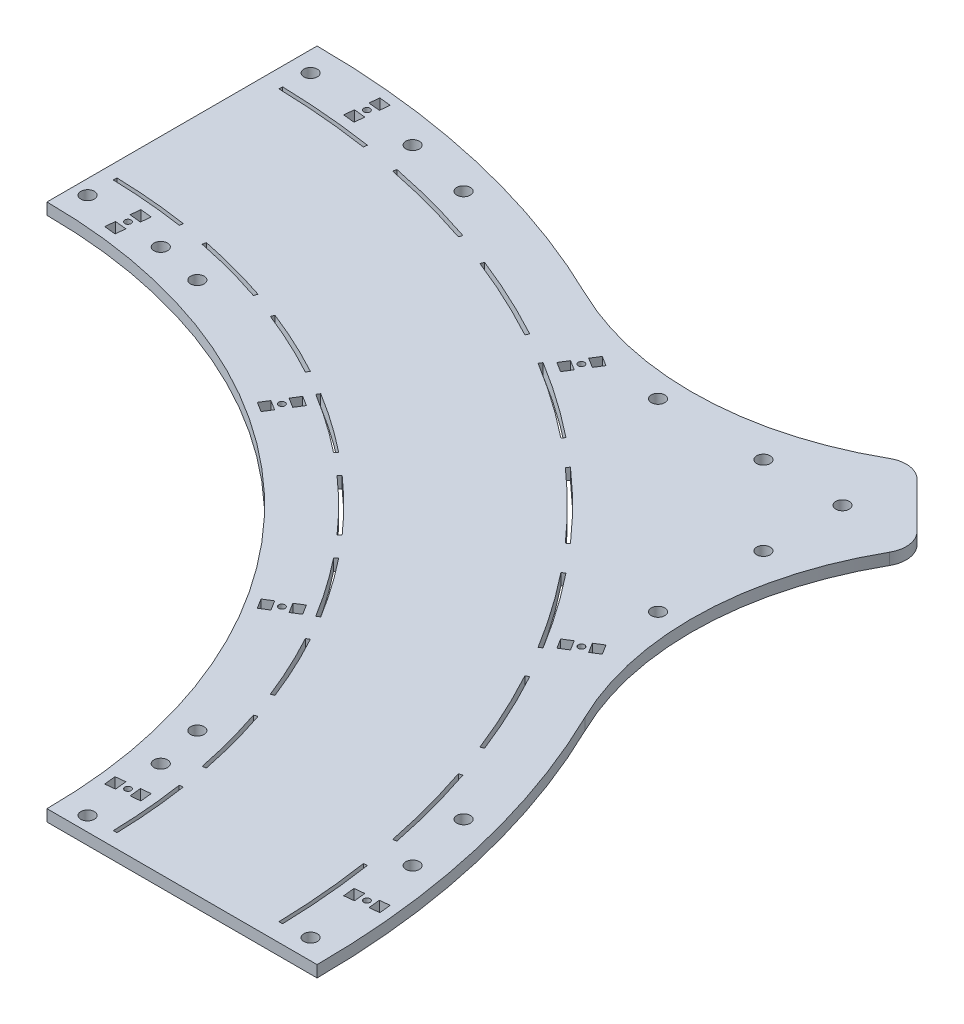
from build123d import *

# Parameters (mm, degrees)
BOSS_EXTRUDE1_DEPTH = 5.588
BOSS_EXTRUDE2_DEPTH = 5.588
CUT_EXTRUDE2_DEPTH  = 543.234577659
CIRPATTERN1_COUNT   = 36
SKETCH8_R           = 1.524
CUT_EXTRUDE3_DEPTH  = 543.234577659
CIRPATTERN3_COUNT   = 4
CIRPATTERN3_ANGLE   = 78
SKETCH9_R           = 3.2639
CUT_EXTRUDE4_DEPTH  = 5.588
FILLET1_R           = 152.4
SKETCH10_R          = 3.2639
CUT_EXTRUDE5_DEPTH  = 5.588
FILLET2_R           = 12.7


with BuildPart() as part:
    # Sketch2 → Boss-Extrude1 (new body)
    with BuildSketch(Plane(origin=(0, 0, 0), x_dir=(1, 0, 0), z_dir=(0, 1, 0))):
        with BuildLine():
            Line((0, 383.397386184), (0, 253.222386184))
            ThreePointArc((0, 253.222386184), (179.055266419, 179.055266419), (253.222386184, 0))
            Line((253.222386184, 0), (383.397386184, 0))
            ThreePointArc((383.397386184, 0), (271.10289166, 271.10289166), (0, 383.397386184))
        make_face()
    extrude(amount=BOSS_EXTRUDE1_DEPTH)

    # Sketch7 → Boss-Extrude2 (add)
    with BuildSketch(Plane(origin=(0, 0, 0), x_dir=(1, 0, 0), z_dir=(0, 1, 0))):
        Polygon((203.145461519, 239.066486003), (239.066486003, 203.145461519), (354.230910668, 318.309886184), (318.309886184, 354.230910668), align=None)
    extrude(amount=BOSS_EXTRUDE2_DEPTH)

    # Sketch3 → Cut-Extrude2 (cut, through all)
    with BuildSketch(Plane(origin=(0, 0, 0), x_dir=(1, 0, 0), z_dir=(0, 1, 0))):
        with BuildLine():
            Line((277.059312997, 41.901281567), (275.32898933, 41.639594716))
            ThreePointArc((275.32898933, 41.639594716), (277.400262248, 24.269378206), (278.376763062, 6.803381548))
            Line((278.376763062, 6.803381548), (280.126240669, 6.846137859))
            ThreePointArc((280.126240669, 6.846137859), (279.143602969, 24.421900756), (277.059312997, 41.901281567))
        make_face()
        with BuildLine():
            Line((354.132872899, 53.557561588), (352.402549232, 53.295874737))
            ThreePointArc((352.402549232, 53.295874737), (355.053638964, 31.063168353), (356.303494191, 8.707869835))
            Line((356.303494191, 8.707869835), (358.052971798, 8.750626146))
            ThreePointArc((358.052971798, 8.750626146), (356.796979685, 31.215690903), (354.132872899, 53.557561588))
        make_face()
    cut_extrude2 = extrude(amount=CUT_EXTRUDE2_DEPTH, mode=Mode.SUBTRACT)

    # CirPattern1: Cut-Extrude2 ×36 about axis
    cirpattern1_axis = Axis((0, 0, 0), (0, 1, 0))
    for i in range(1, CIRPATTERN1_COUNT):
        add(cut_extrude2.rotate(cirpattern1_axis, i * 360 / CIRPATTERN1_COUNT), mode=Mode.SUBTRACT)

    # Sketch8 → Cut-Extrude3 (cut, through all)
    with BuildSketch(Plane(origin=(0, 0, 0), x_dir=(1, 0, 0), z_dir=(0, 1, 0))):
        with Locations(Location((264.465635528, 27.796458376, 0), (0, 0, 270))):
            Circle(SKETCH8_R)
        with Locations(Location((368.666667116, 38.748428115, 0), (0, 0, 270))):
            Circle(SKETCH8_R)
        Polygon((256.86367051, 24.188069523), (261.600081037, 24.68588633), (261.015975984, 30.243274681), (256.279565458, 29.745457875), align=None)
        Polygon((361.064702097, 35.140039262), (365.801112624, 35.637856069), (365.217007571, 41.19524442), (360.480597045, 40.697427614), align=None)
        Polygon((267.915295073, 25.349642071), (272.651705599, 25.847458878), (272.067600546, 31.404847229), (267.33119002, 30.907030423), align=None)
        Polygon((372.11632666, 36.30161181), (376.852737186, 36.799428617), (376.268632134, 42.356816968), (371.532221607, 41.859000162), align=None)
    cut_extrude3 = extrude(amount=CUT_EXTRUDE3_DEPTH, mode=Mode.SUBTRACT)

    # CirPattern3: Cut-Extrude3 ×4 about axis
    cirpattern3_axis = Axis((0, 0, 0), (0, 1, 0))
    for i in range(1, CIRPATTERN3_COUNT):
        add(cut_extrude3.rotate(cirpattern3_axis, i * CIRPATTERN3_ANGLE / (CIRPATTERN3_COUNT - 1)), mode=Mode.SUBTRACT)

    # Sketch9 → Cut-Extrude4 (cut)
    with BuildSketch(Plane(origin=(0, 0, 0), x_dir=(1, 0, 0), z_dir=(0, 1, 0))):
        with Locations(Location((256.861300603, 68.825778063, 0), (0, 0, 270))):
            Circle(SKETCH9_R)
        with Locations(Location((261.882427613, 46.176937762, 0), (0, 0, 270))):
            Circle(SKETCH9_R)
        with Locations(Location((265.831261224, 6.961036557, 0), (0, 0, 270))):
            Circle(SKETCH9_R)
        with Locations(Location((365.065659935, 64.370925577, 0), (0, 0, 270))):
            Circle(SKETCH9_R)
        with Locations(Location((358.066179053, 95.943543514, 0), (0, 0, 270))):
            Circle(SKETCH9_R)
        with Locations(Location((370.570357448, 9.703726316, 0), (0, 0, 270))):
            Circle(SKETCH9_R)
    cut_extrude4 = extrude(amount=CUT_EXTRUDE4_DEPTH, mode=Mode.SUBTRACT)

    # Mirror1: Cut-Extrude4 across plane
    add(cut_extrude4.mirror(Plane(origin=(0, 0, 0), x_dir=(-0.7071067811865477, 0, 0.7071067811865474), z_dir=(-0.7071067811865476, 0, -0.7071067811865476))), mode=Mode.SUBTRACT)

    # Fillet1
    # the kernel refuses this fillet: 152.4 mm, written as the material it adds along each edge
    with BuildSketch(Plane(origin=(288.467809494, 5.588, -252.546785009), x_dir=(0.7071067811865477, 0, -0.7071067811865474), z_dir=(0, -1, 0))) as fillet1_piece_1:
        with BuildLine():
            CenterArc((123.989981876, 149.216524777), FILLET1_R, 199.020127842, 59.248338475)
            Line((-20.08960999, 99.549320229), (-22.971201828, 98.555976138))
            ThreePointArc((-22.971201828, 98.555976138), (-9.721851046, 49.839834029), (-3.041303754, -0.201929389))
            Line((-3.041303754, -0.201929389), (0, -3.048))
            ThreePointArc((0, -3.048), (46.501534792, -3.048), (92.383331339, -2.984330496))
            Line((92.383331339, -2.984330496), (93.003069585, 0))
        make_face()
    extrude(amount=5.588)
    with BuildSketch(Plane(origin=(252.546785009, 5.588, -288.467809494), x_dir=(-0.8330117487164076, 0, -0.553255299568321), z_dir=(0, -1, 0))) as fillet1_piece_2:
        with BuildLine():
            CenterArc((121.740420881, 151.057461901), FILLET1_R, 203.140905646, 59.248338475)
            Line((-18.39765167, 91.165220151), (-21.200413121, 89.967375316))
            ThreePointArc((-21.200413121, 89.967375316), (-12.18659379, 44.97966178), (-2.987767955, -0.602948296))
            Line((-2.987767955, -0.602948296), (0.403684631, -3.021149238))
            ThreePointArc((0.403684631, -3.021149238), (50.778094656, 0.329464554), (101.152504681, -3.021149238))
            Line((101.152504681, -3.021149238), (101.556189312, 0))
        make_face()
    extrude(amount=5.588)

    # Sketch10 → Cut-Extrude5 (cut)
    with BuildSketch(Plane(origin=(0, 0, 0), x_dir=(1, 0, 0), z_dir=(0, 1, 0))):
        with Locations(Location((318.309886184, 229.409886184, 0), (0, 0, 90))):
            Circle(SKETCH10_R)
        with Locations(Location((229.409886184, 318.309886184, 0), (0, 0, 90))):
            Circle(SKETCH10_R)
        with Locations(Location((318.309886184, 318.309886184, 0), (0, 0, 90))):
            Circle(SKETCH10_R)
        with Locations(Location((318.309886184, 280.209886184, 0), (0, 0, 90))):
            Circle(SKETCH10_R)
        with Locations(Location((280.209886184, 318.309886184, 0), (0, 0, 90))):
            Circle(SKETCH10_R)
    extrude(amount=CUT_EXTRUDE5_DEPTH, mode=Mode.SUBTRACT)

    # Fillet2
    fillet2_edges = [part.edges().sort_by_distance(p)[0] for p in [
        (318.309886184, 2.794, -354.230910668),
        (354.230910668, 2.794, -318.309886184),
    ]]
    fillet(fillet2_edges, radius=FILLET2_R)


solid = part.part
